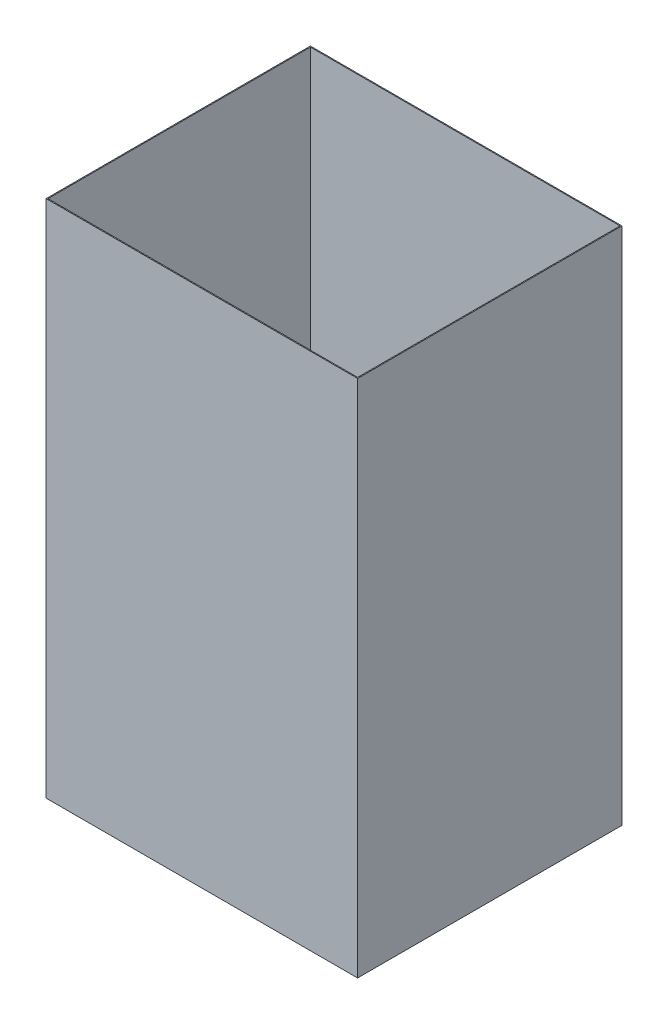
from build123d import *

# Parameters (mm, degrees)
SKETCH1_W           = 838.2
SKETCH1_H           = 711.2
BOSS_EXTRUDE1_DEPTH = 1397
SHELL1_T            = -2.54
CUT_EXTRUDE1_REACH  = 1777.642
SKETCH2_W           = 833.12
SKETCH2_H           = 706.12


with BuildPart() as part:
    # Sketch1 → Boss-Extrude1 (new body)
    with BuildSketch(Plane(origin=(0, 0, 0), x_dir=(1, 0, 0), z_dir=(0, 1, 0))):
        with Locations((419.1, 355.6)):
            Rectangle(SKETCH1_W, SKETCH1_H)
    extrude(amount=BOSS_EXTRUDE1_DEPTH)

    # Shell1
    shell1_openings = [part.faces().sort_by_distance(p)[0] for p in [
        (419.1, 0, -355.6),
    ]]
    offset(amount=SHELL1_T, openings=shell1_openings, kind=Kind.INTERSECTION)

    # Sketch2 → Cut-Extrude1 (cut, up to next)
    with BuildSketch(Plane.XZ.offset(-1394.46), mode=Mode.PRIVATE) as cut_extrude1_sk1:
        with Locations((419.1, -355.6)):
            Rectangle(SKETCH2_W, SKETCH2_H)
    cut_extrude1_tool1 = extrude(cut_extrude1_sk1.sketch, amount=-CUT_EXTRUDE1_REACH, mode=Mode.PRIVATE) & part.part
    add(cut_extrude1_tool1.solids().sort_by_distance((419.1, 1394.46, -355.6))[0], mode=Mode.SUBTRACT)


solid = part.part
